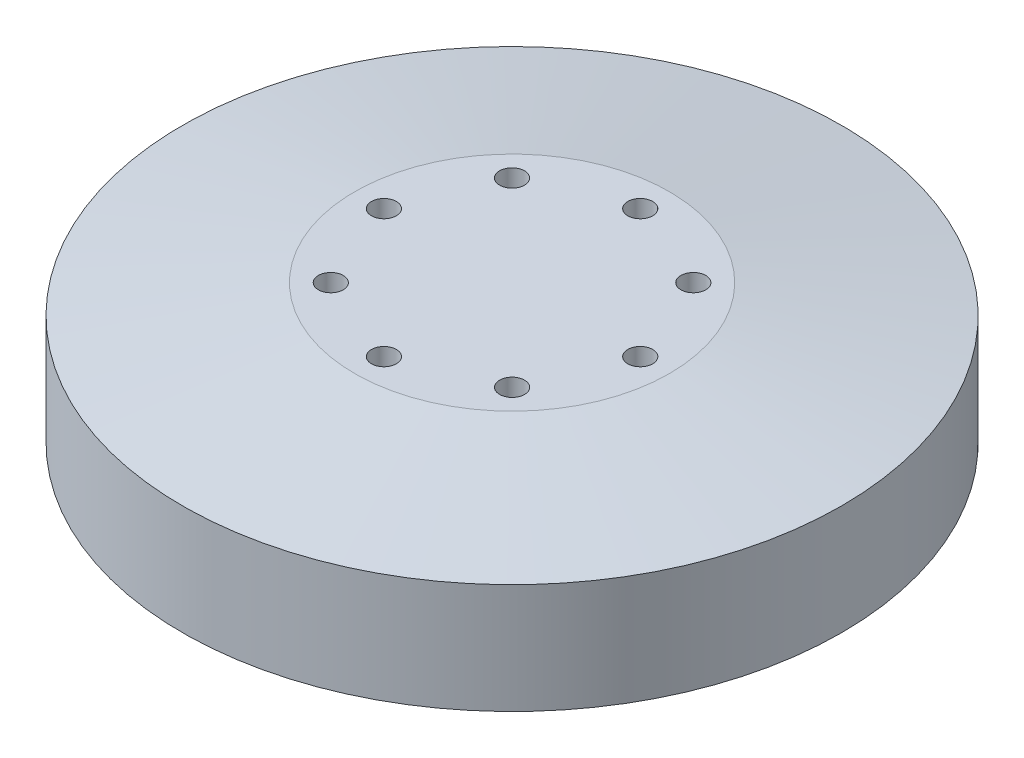
from build123d import *

# Parameters (mm, degrees)
SKETCH2_R                = 43
CUT_EXTRUDE1_DEPTH       = 1
M3_CLEARANCE_HOLE1_D     = 3.4
M3_CLEARANCE_HOLE1_DEPTH = 4
M3_CLEARANCE_HOLE1_TIP   = 1.021463052


with BuildPart() as part:
    # Sketch1 → Revolve1 (revolve)
    with BuildSketch(Plane.XY):
        Polygon((0, -9.45), (0, 9.45), (-21.5, 9.45), (-45, 5.55), (-45, -9.45), align=None)
    revolve(axis=Axis((0, -9.45, 0), (0, 1, 0)))

    # Sketch2 → Cut-Extrude1 (cut)
    with BuildSketch(Plane.XZ.offset(9.45)):
        Circle(SKETCH2_R)
    extrude(amount=-CUT_EXTRUDE1_DEPTH, mode=Mode.SUBTRACT)

    # M3 Clearance Hole1
    with Locations(Plane(origin=(0, 9.45, 0), x_dir=(1, 0, 0), z_dir=(0, 1, 0))):
        with Locations((0, 17.5), (-12.374368671, 12.374368671), (-17.5, 0), (-12.374368671, -12.374368671), (0, -17.5), (12.374368671, -12.374368671), (17.5, 0), (12.374368671, 12.374368671)):
            Hole(M3_CLEARANCE_HOLE1_D / 2, depth=M3_CLEARANCE_HOLE1_DEPTH)
            with Locations((0, 0, -(M3_CLEARANCE_HOLE1_DEPTH + M3_CLEARANCE_HOLE1_TIP / 2))):  # 118° drill point
                Cone(0, M3_CLEARANCE_HOLE1_D / 2, M3_CLEARANCE_HOLE1_TIP, mode=Mode.SUBTRACT)


solid = part.part
